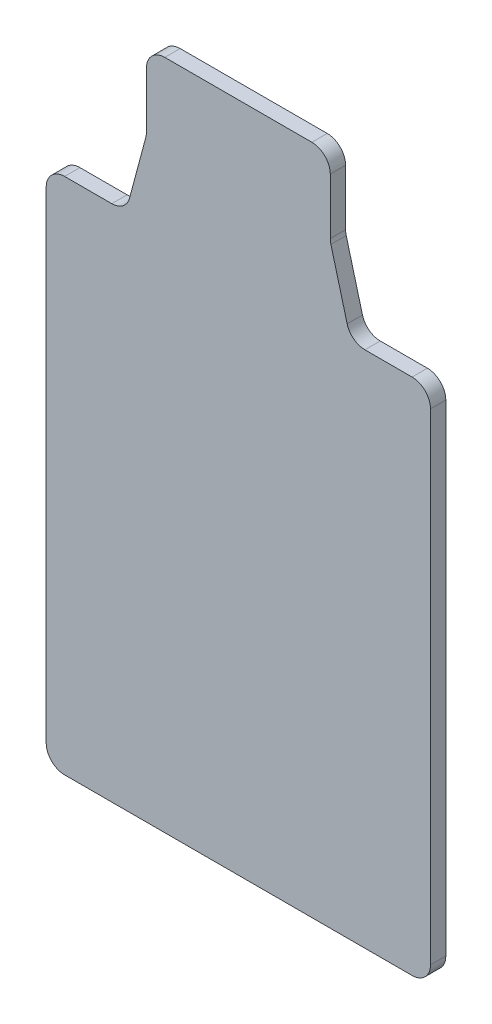
from build123d import *

# Parameters (mm, degrees)
BOSS_EXTRUDE1_DEPTH = 1.25
FILLET1_R           = 3


with BuildPart() as part:
    # Sketch1 → Boss-Extrude1 (new, symmetric)
    with BuildSketch(Plane.XY):
        Polygon((-18.349364905, 42.281834), (-31.35, 42.281834), (-31.35, -42.281834), (31.35, -42.281834), (31.35, 42.281834), (18.349364905, 42.281834), (15, 54.781834), (15, 67.281834), (-15, 67.281834), (-15, 54.781834), align=None)
    extrude(amount=BOSS_EXTRUDE1_DEPTH, both=True)

    # Fillet1
    fillet1_edges = [part.edges().sort_by_distance(p)[0] for p in [
        (15, 54.781834, 0),
        (18.349364905, 42.281834, 0),
        (31.35, 42.281834, 0),
        (31.35, -42.281834, 0),
        (-31.35, -42.281834, 0),
        (15, 67.281834, 0),
        (-15, 67.281834, 0),
        (-31.35, 42.281834, 0),
        (-15, 54.781834, 0),
        (-18.349364905, 42.281834, 0),
    ]]
    fillet(fillet1_edges, radius=FILLET1_R)


solid = part.part
